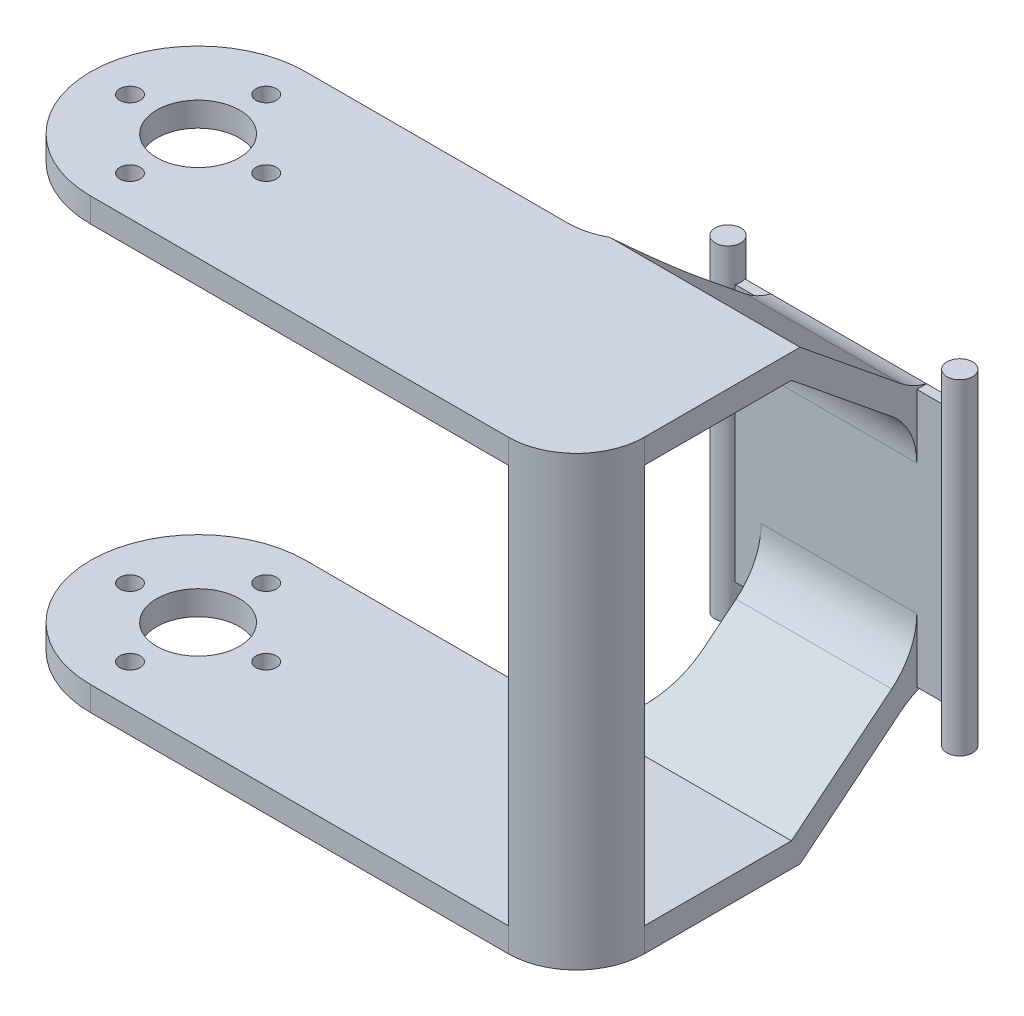
from build123d import *

# Parameters (mm, degrees)
SKETCH1_W           = 23.83
SKETCH1_H           = 1
BOSS_EXTRUDE1_DEPTH = 26.5
SKETCH2_R           = 1.325
BOSS_EXTRUDE2_DEPTH = 16.75
BOSS_EXTRUDE4_DEPTH = 8
SKETCH5_W           = 22.112398437
SKETCH5_H           = 2.5
BOSS_EXTRUDE5_DEPTH = 45
SKETCH6_R           = 4.25
SKETCH6_R_2         = 1.05
CUT_EXTRUDE1_DEPTH  = 79.646360374
FILLET1_R           = 7
FILLET2_R           = 7
FILLET3_R           = 7
BOSS_EXTRUDE6_START = 41
BOSS_EXTRUDE6_DEPTH = 41


with BuildPart() as part:
    # Sketch1 → Boss-Extrude1 (new body)
    with BuildSketch(Plane(origin=(0, 0, 0), x_dir=(1, 0, 0), z_dir=(0, 1, 0))):
        Rectangle(SKETCH1_W, SKETCH1_H)
    extrude(amount=BOSS_EXTRUDE1_DEPTH)

    # Sketch2 → Boss-Extrude2 (add, symmetric)
    with BuildSketch(Plane(origin=(0, 13.25, 0), x_dir=(1, 0, 0), z_dir=(0, 1, 0))):
        with Locations(Location((-11.915, 0, 0), (0, 0, 270))):
            Circle(SKETCH2_R)
        with Locations(Location((11.915, 0, 0), (0, 0, 270))):
            Circle(SKETCH2_R)
    extrude(amount=BOSS_EXTRUDE2_DEPTH, both=True)

    # Sketch4 → Boss-Extrude4 (add, symmetric)
    with BuildSketch(Plane(origin=(0, 0, 0), x_dir=(0, 0, -1), z_dir=(1, 0, 0))):
        Polygon((-0.5, 23.27882373), (-0.5, 26.5), (-12.5, 36.25), (-35.5, 36.25), (-35.5, 33.75), (-13.387601563, 33.75), align=None)
        Polygon((-0.5, 0), (-0.5, 3.22117627), (-13.387601563, -7.25), (-35.5, -7.25), (-35.5, -9.75), (-12.5, -9.75), align=None)
    extrude(amount=BOSS_EXTRUDE4_DEPTH, both=True)

    # Sketch5 → Boss-Extrude5 (add)
    with BuildSketch(Plane.ZY.offset(8)):
        with Locations((24.443800782, 35)):
            Rectangle(SKETCH5_W, SKETCH5_H)
        with Locations((24.443800782, -8.5)):
            Rectangle(SKETCH5_W, SKETCH5_H)
    extrude(amount=BOSS_EXTRUDE5_DEPTH)

    # Sketch6 → Cut-Extrude1 (cut, through all)
    with BuildSketch(Plane(origin=(0, 36.25, 0), x_dir=(1, 0, 0), z_dir=(0, 1, 0))):
        with Locations(Location((-41.943800782, -24.443800782, 0), (0, 0, 270))):
            Circle(SKETCH6_R)
        with Locations(Location((-48.943800782, -24.443800782, 0), (0, 0, 270))):
            Circle(SKETCH6_R_2)
        with Locations(Location((-41.943800782, -17.443800782, 0), (0, 0, 270))):
            Circle(SKETCH6_R_2)
        with Locations(Location((-34.943800782, -24.443800782, 0), (0, 0, 270))):
            Circle(SKETCH6_R_2)
        with Locations(Location((-41.943800782, -31.443800782, 0), (0, 0, 270))):
            Circle(SKETCH6_R_2)
        with BuildLine():
            ThreePointArc((-53, -24.443800782), (-49.761714223, -16.62588734), (-41.943800782, -13.387601563))
            Line((-41.943800782, -13.387601563), (-53, -13.387601563))
            Line((-53, -13.387601563), (-53, -24.443800782))
        make_face()
        with BuildLine():
            ThreePointArc((-41.943800782, -35.5), (-49.761714223, -32.261714223), (-53, -24.443800782))
            Line((-53, -24.443800782), (-53, -35.5))
            Line((-53, -35.5), (-41.943800782, -35.5))
        make_face()
    extrude(amount=-CUT_EXTRUDE1_DEPTH, mode=Mode.SUBTRACT)

    # Fillet1
    # the kernel refuses this fillet: 7 mm, written as the material it adds along each edge
    with BuildSketch(Plane(origin=(-8, -9.75, 13.387601563), x_dir=(-1, 0, 0), z_dir=(0, 1, 0))) as fillet1_piece_1_section:
        with BuildLine():
            CenterArc((FILLET1_R, -FILLET1_R), FILLET1_R, 90, 90)
            Line((0, -FILLET1_R), (0, 0))
            Line((0, 0), (FILLET1_R, 0))
        make_face()
    fillet1_piece_1 = extrude(amount=2.5, mode=Mode.PRIVATE)
    fillet1_piece_1 = split(fillet1_piece_1, bisect_by=Plane(origin=(-9.983413871, -9.198966646, 11.821805103), z_dir=(0, 0.7761140001162655, 0.6305926250944658)), keep=Keep.TOP, mode=Mode.PRIVATE)
    fillet1_piece_1 = split(fillet1_piece_1, bisect_by=Plane(origin=(-9.983413871, -7.258681646, 13.398286665), z_dir=(0, -0.7761140001162655, -0.6305926250944658)), keep=Keep.TOP, mode=Mode.PRIVATE)
    add(fillet1_piece_1)
    with BuildSketch(Plane(origin=(-8, -9.75, 13.387601563), x_dir=(-1, 0, 0), z_dir=(0, 1, 0))) as fillet1_piece_2_section:
        with BuildLine():
            CenterArc((FILLET1_R, -FILLET1_R), FILLET1_R, 90, 90)
            Line((0, -FILLET1_R), (0, 0))
            Line((0, 0), (FILLET1_R, 0))
        make_face()
    fillet1_piece_2 = extrude(amount=20, mode=Mode.PRIVATE)
    fillet1_piece_2 = split(fillet1_piece_2, bisect_by=Plane(origin=(-8.790191319, -7.296205837, 9.479945645), z_dir=(0, 0.7761140001162655, 0.6305926250944658)), keep=Keep.TOP, mode=Mode.PRIVATE)
    fillet1_piece_2 = split(fillet1_piece_2, bisect_by=Plane(origin=(-8.790191319, -7.25, 10.538925052), z_dir=(0, 1, 0)), keep=Keep.TOP, mode=Mode.PRIVATE)
    fillet1_piece_2 = split(fillet1_piece_2, bisect_by=Plane(origin=(-8.790191319, -5.355920836, 11.056427208), z_dir=(0, -0.7761140001162655, -0.6305926250944658)), keep=Keep.TOP, mode=Mode.PRIVATE)
    add(fillet1_piece_2)
    with BuildSketch(Plane(origin=(-8, 36.25, 13.387601563), x_dir=(0, 0, -1), z_dir=(0, -1, 0))) as fillet1_piece_3_section:
        with BuildLine():
            CenterArc((FILLET1_R, -FILLET1_R), FILLET1_R, 90, 90)
            Line((0, -FILLET1_R), (0, 0))
            Line((0, 0), (FILLET1_R, 0))
        make_face()
    fillet1_piece_3 = extrude(amount=2.5, mode=Mode.PRIVATE)
    fillet1_piece_3 = split(fillet1_piece_3, bisect_by=Plane(origin=(-9.983413871, 35.698966646, 11.821805103), z_dir=(0, -0.7761140001162655, 0.6305926250944659)), keep=Keep.TOP, mode=Mode.PRIVATE)
    fillet1_piece_3 = split(fillet1_piece_3, bisect_by=Plane(origin=(-9.983413871, 33.758681646, 13.398286666), z_dir=(0, 0.7761140001162657, -0.6305926250944655)), keep=Keep.TOP, mode=Mode.PRIVATE)
    add(fillet1_piece_3)
    with BuildSketch(Plane(origin=(-8, 36.25, 13.387601563), x_dir=(0, 0, -1), z_dir=(0, -1, 0))) as fillet1_piece_4_section:
        with BuildLine():
            CenterArc((FILLET1_R, -FILLET1_R), FILLET1_R, 90, 90)
            Line((0, -FILLET1_R), (0, 0))
            Line((0, 0), (FILLET1_R, 0))
        make_face()
    fillet1_piece_4 = extrude(amount=20, mode=Mode.PRIVATE)
    fillet1_piece_4 = split(fillet1_piece_4, bisect_by=Plane(origin=(-8.790191317, 33.796205836, 9.479945645), z_dir=(0, -0.7761140001162655, 0.6305926250944659)), keep=Keep.TOP, mode=Mode.PRIVATE)
    fillet1_piece_4 = split(fillet1_piece_4, bisect_by=Plane(origin=(-8.790191317, 31.855920836, 11.056427207), z_dir=(0, 0.7761140001162657, -0.6305926250944655)), keep=Keep.TOP, mode=Mode.PRIVATE)
    fillet1_piece_4 = split(fillet1_piece_4, bisect_by=Plane(origin=(-8.790191317, 33.75, 10.538925051), z_dir=(0, -1, 0)), keep=Keep.TOP, mode=Mode.PRIVATE)
    add(fillet1_piece_4)
    # the kernel refuses this fillet: 7 mm, written as the material it takes off along each edge
    with BuildSketch(Plane(origin=(8, 10.25, 35.5), x_dir=(0, 0, -1), z_dir=(0, -1, 0))) as fillet1_2_piece_1:
        with BuildLine():
            CenterArc((FILLET1_R, -FILLET1_R), FILLET1_R, 90, 90)
            Line((0, -FILLET1_R), (0, 0))
            Line((0, 0), (FILLET1_R, 0))
        make_face()
    extrude(amount=37.5, mode=Mode.SUBTRACT)
    with BuildSketch(Plane(origin=(8, 53.75, 35.5), x_dir=(-1, 0, 0), z_dir=(0, -1, 0))) as fillet1_2_piece_2:
        with BuildLine():
            CenterArc((FILLET1_R, FILLET1_R), FILLET1_R, 180, 90)
            Line((0, FILLET1_R), (0, 0))
            Line((0, 0), (FILLET1_R, 0))
        make_face()
    extrude(amount=37.5, mode=Mode.SUBTRACT)

    # Fillet2
    fillet2_edges = [part.edges().sort_by_distance(p)[0] for p in [
        (0, 23.27882373, 0.5),
        (0, 3.22117627, 0.5),
    ]]
    fillet(fillet2_edges, radius=FILLET2_R)

    # Fillet3
    # the kernel refuses this fillet: 7 mm, written as the material it adds along each edge
    with BuildSketch(Plane(origin=(-8, 26.5, 0.5), x_dir=(0, 0.6305926250951525, 0.7761140001157076), z_dir=(1, 0, 0))) as fillet3_piece_1:
        with BuildLine():
            CenterArc((2.127444109, -7), FILLET3_R, 90, 24.506345334)
            Line((-0.776114, -0.630592625), (0, 0))
            Line((0, 0), (2.127444109, 0))
        make_face()
    extrude(amount=16)
    with BuildSketch(Plane(origin=(8, 0, 0.5), x_dir=(0, 0, -1), z_dir=(-1, 0, 0))) as fillet3_piece_2:
        with BuildLine():
            CenterArc((2.763009218, 6.774348566), FILLET3_R, 230.906141114, 24.506345334)
            Line((-1.651139157, 1.341550565), (0, 0))
            Line((0, 0), (1, 0))
        make_face()
    extrude(amount=16)

    # Sketch8 → Boss-Extrude6 (add)
    with BuildSketch(Plane(origin=(0, -7.25, 0), x_dir=(1, 0, 0), z_dir=(0, 1, 0)).offset(BOSS_EXTRUDE6_START)):
        with BuildLine():
            ThreePointArc((1, -35.5), (5.949747468, -33.449747468), (8, -28.5))
            Line((8, -28.5), (5, -28.5))
            ThreePointArc((5, -28.5), (3.422054899, -30.922054899), (1, -32.5))
            Line((1, -32.5), (1, -35.5))
        make_face()
    extrude(amount=-BOSS_EXTRUDE6_DEPTH)


solid = part.part
